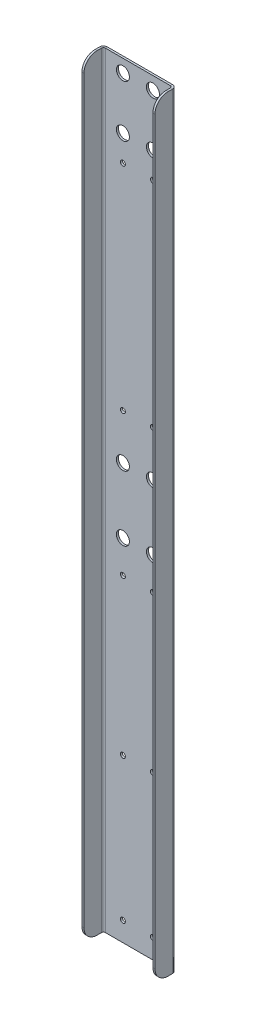
from build123d import *

# Parameters (mm, degrees)
SKETCH1_W                   = 63.5
SKETCH1_H                   = 749.3
BASE_FLANGE1_DEPTH          = 1.984375
F_1_2_0_5_DIAMETER_HOLE1_D  = 12.7
F_1_2_0_5_DIAMETER_HOLE2_D  = 12.7
EDGE_FLANGE2_DEPTH          = 749.3
EDGE_FLANGE2_BEND_DEPTH     = 749.3
F_10_0_201_DIAMETER_HOLE1_D = 4.9149
FILLET1_R                   = 12.7


# Sheet-metal steps are written as plain solids
with BuildPart() as part:
    # Sketch1 → Base-Flange1 (new body)
    with BuildSketch(Plane.XY):
        with Locations((0, 374.65)):
            Rectangle(SKETCH1_W, SKETCH1_H)
    extrude(amount=-BASE_FLANGE1_DEPTH)

    # 1/2 (0.5) Diameter Hole1 (through all)
    with Locations(Plane.XY):
        with Locations((-14.684375, 406.4), (14.684375, 406.4), (14.684375, 342.9), (-14.684375, 342.9)):
            Hole(F_1_2_0_5_DIAMETER_HOLE1_D / 2)

    # 1/2 (0.5) Diameter Hole2 (through all)
    with Locations(Plane.XY):
        with Locations((14.684375, 685.8), (14.684375, 736.6), (-14.684375, 736.6), (-14.684375, 685.8)):
            Hole(F_1_2_0_5_DIAMETER_HOLE2_D / 2)

    # Edge-Flange2 section (across the edge) → Edge-Flange2 (add)
    with BuildSketch(Plane(origin=(-33.734375, 749.3, 0), x_dir=(1, 0, 0), z_dir=(0, -1, 0))):
        with BuildLine():
            Line((-1.984375, 1.984375), (-1.984375, 19.05))
            Line((-1.984375, 19.05), (0, 19.05))
            Line((0, 19.05), (0, 1.984375))
            ThreePointArc((0, 1.984375), (0.581209981, 0.581209981), (1.984375, 0))
            Line((1.984375, 0), (1.984375, -1.984375))
            ThreePointArc((1.984375, -1.984375), (-0.821955038, -0.821955038), (-1.984375, 1.984375))
        make_face()
    extrude(amount=EDGE_FLANGE2_DEPTH)

    # Edge-Flange2 section 2 (across the edge) → Edge-Flange2 bend (add)
    with BuildSketch(Plane(origin=(33.734375, 0, 0), x_dir=(-1, 0, 0), z_dir=(0, 1, 0))):
        with BuildLine():
            Line((-1.984375, 1.984375), (-1.984375, 19.05))
            Line((-1.984375, 19.05), (0, 19.05))
            Line((0, 19.05), (0, 1.984375))
            ThreePointArc((0, 1.984375), (0.581209981, 0.581209981), (1.984375, 0))
            Line((1.984375, 0), (1.984375, -1.984375))
            ThreePointArc((1.984375, -1.984375), (-0.821955038, -0.821955038), (-1.984375, 1.984375))
        make_face()
    extrude(amount=EDGE_FLANGE2_BEND_DEPTH)

    # #10 (0.201) Diameter Hole1 (through all)
    with Locations(Plane(origin=(0, 0, -1.984375), x_dir=(-1, 0, 0), z_dir=(0, 0, -1))):
        with Locations((-14.684375, 19.05), (14.684375, 19.05), (-14.684375, 158.75), (14.684375, 158.75), (-14.684375, 311.15), (14.684375, 311.15), (-14.684375, 450.85), (14.684375, 450.85), (-14.684375, 660.4), (14.684375, 660.4)):
            Hole(F_10_0_201_DIAMETER_HOLE1_D / 2)

    # Fillet1
    fillet1_edges = [part.edges().sort_by_distance(p)[0] for p in [
        (-34.7265625, 749.3, 19.05),
        (-34.7265625, 0, 19.05),
        (34.7265625, 0, 19.05),
        (34.7265625, 749.3, 19.05),
    ]]
    fillet(fillet1_edges, radius=FILLET1_R)


solid = part.part
